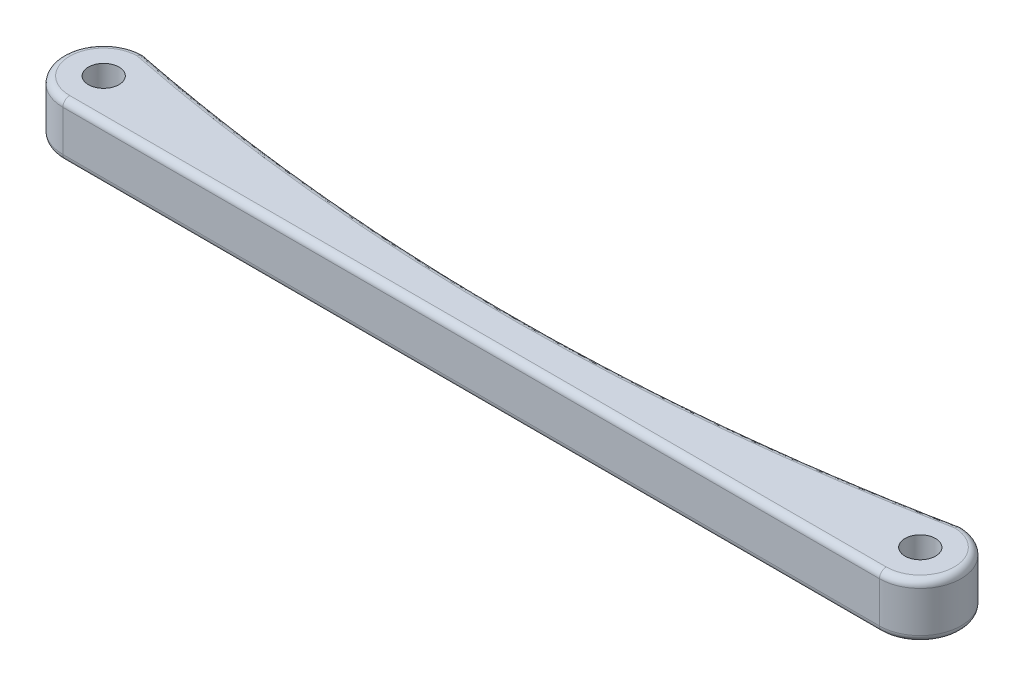
from build123d import *

# Parameters (mm, degrees)
SKETCH2_R               = 1.125
BOSS_EXTRUDE1_DEPTH     = 4
CUT_EXTRUDE1_DEPTH      = 64.198101237
CUT_EXTRUDE1_DEPTH_BACK = 64.198101237
FILLET2_R               = 0.5


with BuildPart() as part:
    # Sketch2 → Boss-Extrude1 (new body)
    with BuildSketch(Plane(origin=(0, 0, 0), x_dir=(1, 0, 0), z_dir=(0, 1, 0))):
        with BuildLine():
            Line((0, 3), (60, 3))
            ThreePointArc((60, 3), (63, 0), (60, -3))
            Line((60, -3), (0, -3))
            ThreePointArc((0, -3), (-3, 0), (0, 3))
        make_face()
        Circle(SKETCH2_R, mode=Mode.SUBTRACT)
        with Locations((60, 0)):
            Circle(SKETCH2_R, mode=Mode.SUBTRACT)
    extrude(amount=BOSS_EXTRUDE1_DEPTH)

    # Sketch3 → Cut-Extrude1 (cut, two sides: drawn at the far end of the back side and taken through both)
    with BuildSketch(Plane(origin=(0, 4, 0), x_dir=(1, 0, 0), z_dir=(0, 1, 0)).offset(-CUT_EXTRUDE1_DEPTH_BACK)):
        with BuildLine():
            Line((0, 3), (60, 3))
            add(Edge.make_bspline(
                [(0, 3), (30, -3), (60, 3)],
                knots=[0, 0, 0, 1, 1, 1], degree=2))
        make_face()
    extrude(amount=CUT_EXTRUDE1_DEPTH + CUT_EXTRUDE1_DEPTH_BACK, mode=Mode.SUBTRACT)

    # Fillet2
    fillet2_edges = [part.edges().sort_by_distance(p)[0] for p in [
        (63, 0, 0),
        (30, 0, 3),
        (63, 4, 0),
        (30, 4, 3),
        (-3, 0, 0),
        (30, 0, 0),
        (-3, 4, 0),
        (30, 4, 0),
        (60, 2, -3),
        (0, 2, -3),
    ]]
    fillet(fillet2_edges, radius=FILLET2_R)


solid = part.part
